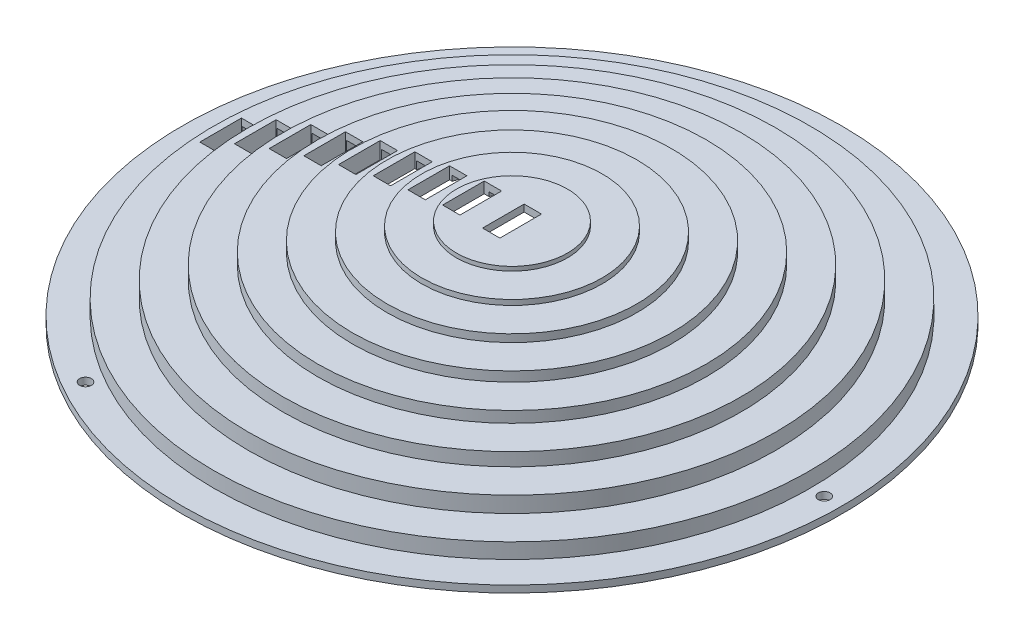
from build123d import *

# Parameters (mm, degrees)
ESQUISSE1_R             = 95
BOSS_EXTRU_1_DEPTH      = 2
ESQUISSE1_12_R          = 86
ESQUISSE1_12_R_2        = 76
BOSS_EXTRU_11_DEPTH     = 4.42
ESQUISSE1_4_R           = 76
BOSS_EXTRU_3_DEPTH      = 9
ESQUISSE1_5_R           = 66
BOSS_EXTRU_4_DEPTH      = 12.8
ESQUISSE1_6_R           = 56
BOSS_EXTRU_5_DEPTH      = 16
ESQUISSE1_7_R           = 46
BOSS_EXTRU_6_DEPTH      = 18.8
ESQUISSE1_8_R           = 36
BOSS_EXTRU_7_DEPTH      = 21
ESQUISSE1_9_R           = 26
BOSS_EXTRU_8_DEPTH      = 22.5
ESQUISSE1_10_R          = 16
BOSS_EXTRU_9_DEPTH      = 23.7
COQUE1_START            = -2
COQUE1_OUTLINE_R        = 64
COQUE1_DEPTH            = 12.8
COQUE1_2_OUTLINE_R      = 84
COQUE1_2_OUTLINE_R_2    = 64
COQUE1_2_DEPTH          = 4.42
COQUE1_START_2          = 10.8
COQUE1_3_OUTLINE_R      = 44
COQUE1_3_DEPTH          = 6
COQUE1_START_3          = 2.42
COQUE1_4_OUTLINE_R      = 74
COQUE1_4_OUTLINE_R_2    = 64
COQUE1_4_DEPTH          = 4.58
COQUE1_5_OUTLINE_R      = 54
COQUE1_5_OUTLINE_R_2    = 44
COQUE1_5_DEPTH          = 3.2
COQUE1_START_4          = 16.8
COQUE1_6_OUTLINE_R      = 34
COQUE1_6_DEPTH          = 2.2
COQUE1_START_5          = 19
COQUE1_7_OUTLINE_R      = 24
COQUE1_7_DEPTH          = 1.5
COQUE1_START_6          = 20.5
COQUE1_8_OUTLINE_R      = 14
COQUE1_8_DEPTH          = 1.2
ESQUISSE4_W             = 5
ESQUISSE4_H             = 12
ENL_V_MAT_EXTRU_2_DEPTH = 137.786293173
D_GAGEMENT_M31_D        = 3.4


# Read off the part's stored shape, not the designer's step: Coque1
with BuildPart() as part:
    # Esquisse1 → Boss.-Extru.1 (new body)
    with BuildSketch(Plane(origin=(0, 0, 0), x_dir=(1, 0, 0), z_dir=(0, 1, 0))):
        with Locations(Location((0, 0, 0), (0, 0, 270))):
            Circle(ESQUISSE1_R)
    extrude(amount=-BOSS_EXTRU_1_DEPTH)

    # Esquisse1<12> → Boss.-Extru.11 (add)
    with BuildSketch(Plane(origin=(0, 0, 0), x_dir=(1, 0, 0), z_dir=(0, 1, 0))):
        with Locations(Location((0, 0, 0), (0, 0, 270))):
            Circle(ESQUISSE1_12_R)
        with Locations(Location((0, 0, 0), (0, 0, 270))):
            Circle(ESQUISSE1_12_R_2, mode=Mode.SUBTRACT)
    extrude(amount=BOSS_EXTRU_11_DEPTH)

    # Esquisse1<4> → Boss.-Extru.3 (add)
    with BuildSketch(Plane(origin=(0, 0, 0), x_dir=(1, 0, 0), z_dir=(0, 1, 0))):
        with Locations(Location((0, 0, 0), (0, 0, 270))):
            Circle(ESQUISSE1_4_R)
    extrude(amount=BOSS_EXTRU_3_DEPTH)

    # Esquisse1<5> → Boss.-Extru.4 (add)
    with BuildSketch(Plane(origin=(0, 0, 0), x_dir=(1, 0, 0), z_dir=(0, 1, 0))):
        with Locations(Location((0, 0, 0), (0, 0, 270))):
            Circle(ESQUISSE1_5_R)
    extrude(amount=BOSS_EXTRU_4_DEPTH)

    # Esquisse1<6> → Boss.-Extru.5 (add)
    with BuildSketch(Plane(origin=(0, 0, 0), x_dir=(1, 0, 0), z_dir=(0, 1, 0))):
        with Locations(Location((0, 0, 0), (0, 0, 270))):
            Circle(ESQUISSE1_6_R)
    extrude(amount=BOSS_EXTRU_5_DEPTH)

    # Esquisse1<7> → Boss.-Extru.6 (add)
    with BuildSketch(Plane(origin=(0, 0, 0), x_dir=(1, 0, 0), z_dir=(0, 1, 0))):
        with Locations(Location((0, 0, 0), (0, 0, 270))):
            Circle(ESQUISSE1_7_R)
    extrude(amount=BOSS_EXTRU_6_DEPTH)

    # Esquisse1<8> → Boss.-Extru.7 (add)
    with BuildSketch(Plane(origin=(0, 0, 0), x_dir=(1, 0, 0), z_dir=(0, 1, 0))):
        with Locations(Location((0, 0, 0), (0, 0, 90))):
            Circle(ESQUISSE1_8_R)
    extrude(amount=BOSS_EXTRU_7_DEPTH)

    # Esquisse1<9> → Boss.-Extru.8 (add)
    with BuildSketch(Plane(origin=(0, 0, 0), x_dir=(1, 0, 0), z_dir=(0, 1, 0))):
        with Locations(Location((0, 0, 0), (0, 0, 270))):
            Circle(ESQUISSE1_9_R)
    extrude(amount=BOSS_EXTRU_8_DEPTH)

    # Esquisse1<10> → Boss.-Extru.9 (add)
    with BuildSketch(Plane(origin=(0, 0, 0), x_dir=(1, 0, 0), z_dir=(0, 1, 0))):
        with Locations(Location((0, 0, 0), (0, 0, 270))):
            Circle(ESQUISSE1_10_R)
    extrude(amount=BOSS_EXTRU_9_DEPTH)

    # Coque1 outline → Coque1 (cut)
    with BuildSketch(Plane(origin=(0, 0, 0), x_dir=(1, 0, 0), z_dir=(0, 1, 0)).offset(COQUE1_START)):
        Circle(COQUE1_OUTLINE_R)
    extrude(amount=COQUE1_DEPTH, mode=Mode.SUBTRACT)

    # Coque1 2 outline → Coque1 2 (cut)
    with BuildSketch(Plane(origin=(0, 0, 0), x_dir=(1, 0, 0), z_dir=(0, 1, 0)).offset(COQUE1_START)):
        Circle(COQUE1_2_OUTLINE_R)
        Circle(COQUE1_2_OUTLINE_R_2, mode=Mode.SUBTRACT)
    extrude(amount=COQUE1_2_DEPTH, mode=Mode.SUBTRACT)

    # Coque1 3 outline → Coque1 3 (cut)
    with BuildSketch(Plane(origin=(0, 0, 0), x_dir=(1, 0, 0), z_dir=(0, 1, 0)).offset(COQUE1_START_2)):
        Circle(COQUE1_3_OUTLINE_R)
    extrude(amount=COQUE1_3_DEPTH, mode=Mode.SUBTRACT)

    # Coque1 4 outline → Coque1 4 (cut)
    with BuildSketch(Plane(origin=(0, 0, 0), x_dir=(1, 0, 0), z_dir=(0, 1, 0)).offset(COQUE1_START_3)):
        Circle(COQUE1_4_OUTLINE_R)
        Circle(COQUE1_4_OUTLINE_R_2, mode=Mode.SUBTRACT)
    extrude(amount=COQUE1_4_DEPTH, mode=Mode.SUBTRACT)

    # Coque1 5 outline → Coque1 5 (cut)
    with BuildSketch(Plane(origin=(0, 0, 0), x_dir=(1, 0, 0), z_dir=(0, 1, 0)).offset(COQUE1_START_2)):
        Circle(COQUE1_5_OUTLINE_R)
        Circle(COQUE1_5_OUTLINE_R_2, mode=Mode.SUBTRACT)
    extrude(amount=COQUE1_5_DEPTH, mode=Mode.SUBTRACT)

    # Coque1 6 outline → Coque1 6 (cut)
    with BuildSketch(Plane(origin=(0, 0, 0), x_dir=(1, 0, 0), z_dir=(0, 1, 0)).offset(COQUE1_START_4)):
        Circle(COQUE1_6_OUTLINE_R)
    extrude(amount=COQUE1_6_DEPTH, mode=Mode.SUBTRACT)

    # Coque1 7 outline → Coque1 7 (cut)
    with BuildSketch(Plane(origin=(0, 0, 0), x_dir=(1, 0, 0), z_dir=(0, 1, 0)).offset(COQUE1_START_5)):
        Circle(COQUE1_7_OUTLINE_R)
    extrude(amount=COQUE1_7_DEPTH, mode=Mode.SUBTRACT)

    # Coque1 8 outline → Coque1 8 (cut)
    with BuildSketch(Plane(origin=(0, 0, 0), x_dir=(1, 0, 0), z_dir=(0, 1, 0)).offset(COQUE1_START_6)):
        Circle(COQUE1_8_OUTLINE_R)
    extrude(amount=COQUE1_8_DEPTH, mode=Mode.SUBTRACT)

    # Esquisse4 → Enlèv. mat.-Extru.2 (cut, through all)
    with BuildSketch(Plane(origin=(0, 23.7, 0), x_dir=(1, 0, 0), z_dir=(0, 1, 0))):
        with Locations((-21.5, 0)):
            Rectangle(ESQUISSE4_W, ESQUISSE4_H)
        Rectangle(ESQUISSE4_W, ESQUISSE4_H)
        with Locations((-11.5, 0)):
            Rectangle(ESQUISSE4_W, ESQUISSE4_H)
        with Locations((-31.5, 0)):
            Rectangle(ESQUISSE4_W, ESQUISSE4_H)
        with Locations((-41.5, 0)):
            Rectangle(ESQUISSE4_W, ESQUISSE4_H)
        with Locations((-51.5, 0)):
            Rectangle(ESQUISSE4_W, ESQUISSE4_H)
        with Locations((-61.5, 0)):
            Rectangle(ESQUISSE4_W, ESQUISSE4_H)
        with Locations((-71.5, 0)):
            Rectangle(ESQUISSE4_W, ESQUISSE4_H)
        with Locations((-81.5, 0)):
            Rectangle(ESQUISSE4_W, ESQUISSE4_H)
    extrude(amount=-ENL_V_MAT_EXTRU_2_DEPTH, mode=Mode.SUBTRACT)

    # Dégagement M31 (through all)
    with Locations(Plane(origin=(0, 0, 0), x_dir=(1, 0, 0), z_dir=(0, 1, 0))):
        with Locations((90, 0), (-45, 77.942286341), (-45, -77.942286341)):
            Hole(D_GAGEMENT_M31_D / 2)


solid = part.part
